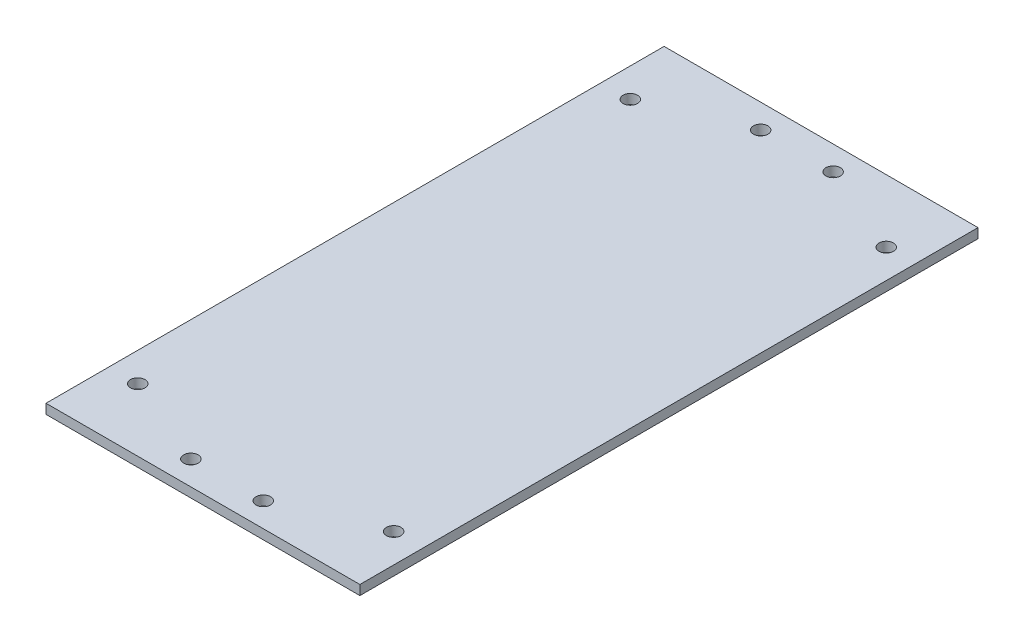
from build123d import *

# Parameters (mm, degrees)
SKETCH_1_W          = 65
SKETCH_1_H          = 128
SKETCH_1_R          = 1.5
EXTRUDE_1_DEPTH     = 2
SKETCH_2_R          = 1.5
CUT_EXTRUDE_1_DEPTH = 106.177758243


with BuildPart() as part:
    # Эскиз1 → Бобышка-Вытянуть1 (new body)
    with BuildSketch(Plane(origin=(0, 0, 0), x_dir=(1, 0, 0), z_dir=(0, 1, 0))):
        with Locations((-41.85845893, -10.35845893)):
            Rectangle(SKETCH_1_W, SKETCH_1_H)
        with Locations((-68.35845893, 40.64154107)):
            Circle(SKETCH_1_R, mode=Mode.SUBTRACT)
        with Locations((-15.35845893, 40.64154107)):
            Circle(SKETCH_1_R, mode=Mode.SUBTRACT)
        with Locations((-15.35845893, -61.35845893)):
            Circle(SKETCH_1_R, mode=Mode.SUBTRACT)
        with Locations((-68.35845893, -61.35845893)):
            Circle(SKETCH_1_R, mode=Mode.SUBTRACT)
    extrude(amount=EXTRUDE_1_DEPTH)

    # Эскиз2 → Вырез-Вытянуть1 (cut, through all)
    with BuildSketch(Plane(origin=(0, 2, 0), x_dir=(1, 0, 0), z_dir=(0, 1, 0))):
        with Locations((-49.35845893, 48.64154107)):
            Circle(SKETCH_2_R)
        with Locations((-34.35845893, 48.64154107)):
            Circle(SKETCH_2_R)
        with Locations((-34.35845893, -69.35845893)):
            Circle(SKETCH_2_R)
        with Locations((-49.35845893, -69.35845893)):
            Circle(SKETCH_2_R)
    extrude(amount=-CUT_EXTRUDE_1_DEPTH, mode=Mode.SUBTRACT)


solid = part.part
